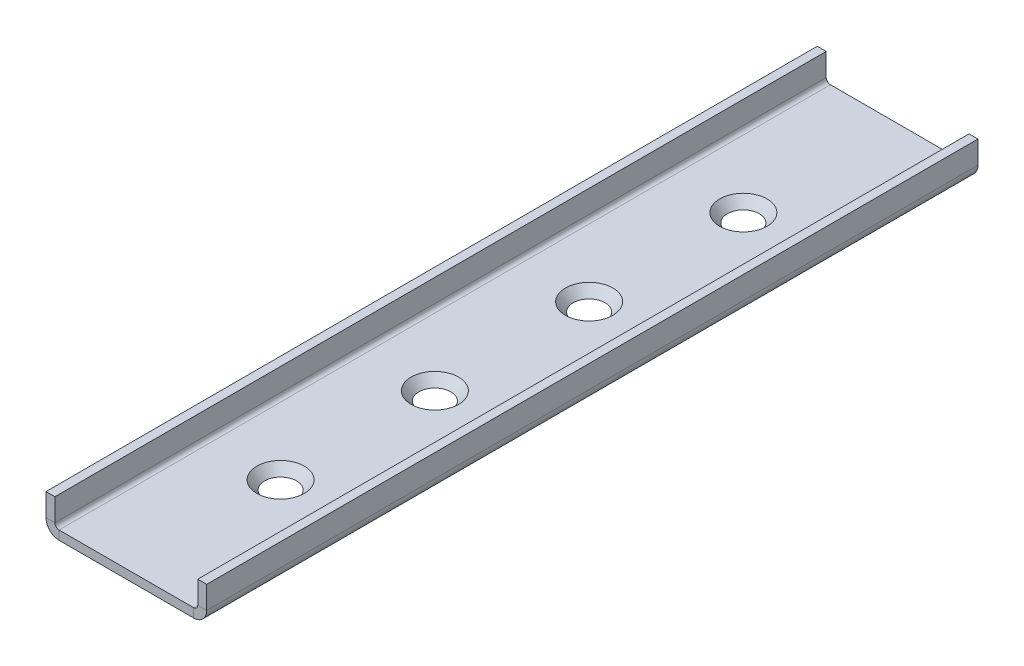
from build123d import *

# Parameters (mm, degrees)
SKETCH1_W                                     = 28.575
SKETCH1_H                                     = 137.16
BASE_FLANGE1_DEPTH                            = 1.5875
EDGE_FLANGE1_STRIP_W                          = 7.8232
EDGE_FLANGE1_STRIP_H                          = 1.5875
EDGE_FLANGE1_STRIP_CUT_DEPTH                  = 137.16
EDGE_FLANGE1_DEPTH                            = 137.16
CSK_FOR_8_FLAT_HEAD_MACHINE_SCREW1_AT_2_COUNT = 2
CSK_FOR_8_FLAT_HEAD_MACHINE_SCREW1_AT_2_PITCH = 27.432
CSK_FOR_8_FLAT_HEAD_MACHINE_SCREW1_AT_3_COUNT = 2
CSK_FOR_8_FLAT_HEAD_MACHINE_SCREW1_AT_3_PITCH = 54.864
CSK_FOR_8_FLAT_HEAD_MACHINE_SCREW1_AT_4_COUNT = 2
CSK_FOR_8_FLAT_HEAD_MACHINE_SCREW1_AT_4_PITCH = 82.296


# Sheet-metal steps are written as plain solids
with BuildPart() as part:
    # Sketch1 → Base-Flange1 (new body)
    with BuildSketch(Plane(origin=(0, 0, 0), x_dir=(1, 0, 0), z_dir=(0, 1, 0))):
        Rectangle(SKETCH1_W, SKETCH1_H)
    extrude(amount=-BASE_FLANGE1_DEPTH)

    # Edge-Flange1 strip (across the edge) → Edge-Flange1 strip cut (cut)
    with BuildSketch(Plane(origin=(-14.2875, 0, -68.58), x_dir=(1, 0, 0), z_dir=(0, 0, 1))):
        with Locations((-1.5875, -0.79375)):
            Rectangle(EDGE_FLANGE1_STRIP_W, EDGE_FLANGE1_STRIP_H)
    edge_flange1_strip_cut = extrude(amount=EDGE_FLANGE1_STRIP_CUT_DEPTH, mode=Mode.SUBTRACT)

    # Edge-Flange1 section (across the edge) → Edge-Flange1 (add)
    with BuildSketch(Plane(origin=(-14.2875, 0, -68.58), x_dir=(1, 0, 0), z_dir=(0, 0, 1))):
        with BuildLine():
            Line((0, 0.7366), (0, 4.7625))
            Line((0, 4.7625), (1.5875, 4.7625))
            Line((1.5875, 4.7625), (1.5875, 0.7366))
            ThreePointArc((1.5875, 0.7366), (1.803245145, 0.215745145), (2.3241, 0))
            Line((2.3241, 0), (2.3241, -1.5875))
            ThreePointArc((2.3241, -1.5875), (0.68071313, -0.90678687), (0, 0.7366))
        make_face()
    edge_flange1 = extrude(amount=EDGE_FLANGE1_DEPTH)

    # Mirror1: Edge-Flange1 strip cut, Edge-Flange1 across plane
    add(edge_flange1_strip_cut.mirror(Plane(origin=(0, 0, 0), x_dir=(0, 0, 1), z_dir=(1, 0, 0))), mode=Mode.SUBTRACT)
    add(edge_flange1.mirror(Plane(origin=(0, 0, 0), x_dir=(0, 0, 1), z_dir=(1, 0, 0))))

    # Sketch11 → CSK for #8 Flat Head Machine Screw1 (revolve, cut)
    with BuildSketch(Plane(origin=(0, 0, 41.148), x_dir=(0, 0, 1), z_dir=(1, 0, 0))):
        Polygon((0, 0), (0, 1.5875), (2.2479, 1.5875), (2.2479, 2.26450021), (4.2164, 0), align=None)
    csk_for_8_flat_head_machine_screw1 = revolve(axis=Axis((0, 6.35, 41.148), (0, -1, 0)), mode=Mode.SUBTRACT)

    # CSK for #8 Flat Head Machine Screw1 at 2: CSK for #8 Flat Head Machine Screw1 ×2
    with Locations(*[(0, 0, -i * CSK_FOR_8_FLAT_HEAD_MACHINE_SCREW1_AT_2_PITCH) for i in range(1, CSK_FOR_8_FLAT_HEAD_MACHINE_SCREW1_AT_2_COUNT)]):
        add(csk_for_8_flat_head_machine_screw1, mode=Mode.SUBTRACT)

    # CSK for #8 Flat Head Machine Screw1 at 3: CSK for #8 Flat Head Machine Screw1 ×2
    with Locations(*[(0, 0, -i * CSK_FOR_8_FLAT_HEAD_MACHINE_SCREW1_AT_3_PITCH) for i in range(1, CSK_FOR_8_FLAT_HEAD_MACHINE_SCREW1_AT_3_COUNT)]):
        add(csk_for_8_flat_head_machine_screw1, mode=Mode.SUBTRACT)

    # CSK for #8 Flat Head Machine Screw1 at 4: CSK for #8 Flat Head Machine Screw1 ×2
    with Locations(*[(0, 0, -i * CSK_FOR_8_FLAT_HEAD_MACHINE_SCREW1_AT_4_PITCH) for i in range(1, CSK_FOR_8_FLAT_HEAD_MACHINE_SCREW1_AT_4_COUNT)]):
        add(csk_for_8_flat_head_machine_screw1, mode=Mode.SUBTRACT)


solid = part.part
